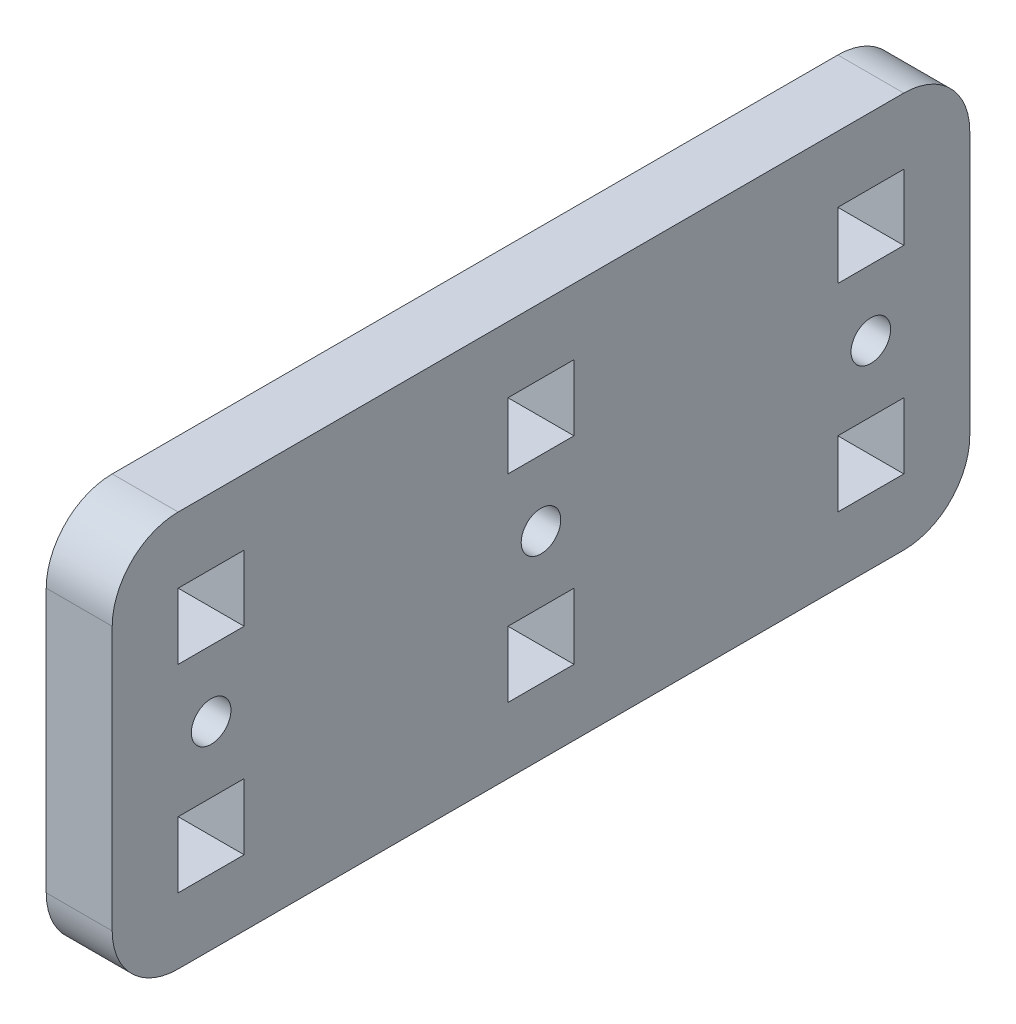
from build123d import *

# Parameters (mm, degrees)
SKETCH1_W           = 65
SKETCH1_H           = 30
SKETCH1_R           = 1.5
SKETCH1_W_2         = 5
SKETCH1_H_2         = 5
BOSS_EXTRUDE1_DEPTH = 5
FILLET1_R           = 5


with BuildPart() as part:
    # Sketch1 → Boss-Extrude1 (new body)
    with BuildSketch(Plane(origin=(0, 0, 0), x_dir=(0, 0, -1), z_dir=(1, 0, 0))):
        with Locations((32.5, 15)):
            Rectangle(SKETCH1_W, SKETCH1_H)
        with Locations((7.5, 15)):
            Circle(SKETCH1_R, mode=Mode.SUBTRACT)
        with Locations((57.5, 15)):
            Circle(SKETCH1_R, mode=Mode.SUBTRACT)
        with Locations((32.5, 15)):
            Circle(SKETCH1_R, mode=Mode.SUBTRACT)
        with Locations((7.5, 22.5)):
            Rectangle(SKETCH1_W_2, SKETCH1_H_2, mode=Mode.SUBTRACT)
        with Locations((7.5, 7.5)):
            Rectangle(SKETCH1_W_2, SKETCH1_H_2, mode=Mode.SUBTRACT)
        with Locations((57.5, 22.5)):
            Rectangle(SKETCH1_W_2, SKETCH1_H_2, mode=Mode.SUBTRACT)
        with Locations((57.5, 7.5)):
            Rectangle(SKETCH1_W_2, SKETCH1_H_2, mode=Mode.SUBTRACT)
        with Locations((32.5, 22.5)):
            Rectangle(SKETCH1_W_2, SKETCH1_H_2, mode=Mode.SUBTRACT)
        with Locations((32.5, 7.5)):
            Rectangle(SKETCH1_W_2, SKETCH1_H_2, mode=Mode.SUBTRACT)
    extrude(amount=BOSS_EXTRUDE1_DEPTH)

    # Fillet1
    fillet1_edges = [part.edges().sort_by_distance(p)[0] for p in [
        (2.5, 0, -65),
        (2.5, 30, -65),
        (2.5, 0, 0),
        (2.5, 30, 0),
    ]]
    fillet(fillet1_edges, radius=FILLET1_R)


solid = part.part
